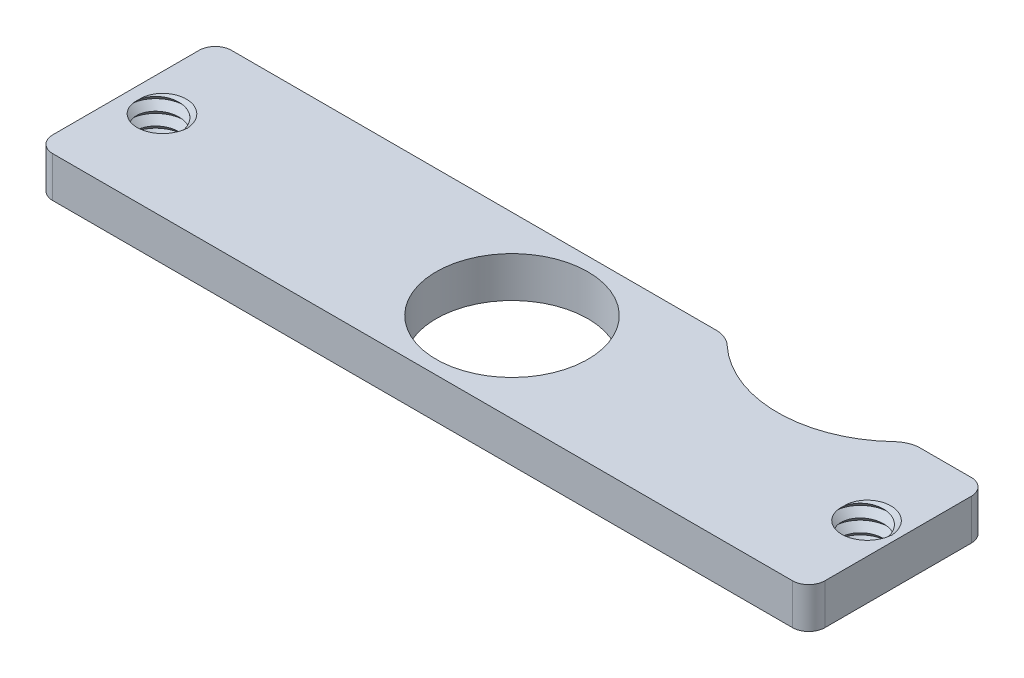
from build123d import *

# Parameters (mm, degrees)
SKETCH1_R           = 5
SKETCH1_R_2         = 17.78
BOSS_EXTRUDE1_DEPTH = 9.525
CUT_SWEEP1_PITCH    = 3
CUT_SWEEP3_PITCH    = 3
FILLET1_R           = 6.35
FILLET2_R           = 3.81


with BuildPart() as part:
    # Sketch1 → Boss-Extrude1 (new body)
    with BuildSketch(Plane(origin=(0, 0, 0), x_dir=(1, 0, 0), z_dir=(0, 1, 0))):
        with BuildLine():
            Line((-90.4875, 20.955), (-90.4875, -20.955))
            Line((-90.4875, -20.955), (90.4875, -20.955))
            Line((90.4875, -20.955), (90.4875, 20.955))
            Line((90.4875, 20.955), (72.098547486, 20.955))
            ThreePointArc((72.098547486, 20.955), (50.8, 11.43), (29.501452514, 20.955))
            Line((29.501452514, 20.955), (-90.4875, 20.955))
        make_face()
        with Locations(Location((-82.55, 0, 0), (0, 0, 90))):
            Circle(SKETCH1_R, mode=Mode.SUBTRACT)
        with Locations(Location((0, 0, 0), (0, 0, 90))):
            Circle(SKETCH1_R_2, mode=Mode.SUBTRACT)
        with Locations(Location((82.55, 0, 0), (0, 0, 90))):
            Circle(SKETCH1_R, mode=Mode.SUBTRACT)
    extrude(amount=BOSS_EXTRUDE1_DEPTH)

    # Cut-Sweep1: arcs per turn and ends read off the stored shape
    # Cut-Sweep1: the profile of Sketch5 profile screwed along a right-hand helix through 5 turns, 10 arcs to a turn; built about Z, then put on its axis
    cut_sweep1_z = Axis((0, 0, 0), (0, 0, 1))
    cut_sweep1_corners = [(4.9997, 0, -0.7497), (4.9997, 0, -3.7493), (6.4995, 0, -2.2495)]
    with BuildLine(mode=Mode.PRIVATE) as cut_sweep1_profile:
        Line(cut_sweep1_corners[0], cut_sweep1_corners[1])
        Line(cut_sweep1_corners[1], cut_sweep1_corners[2])
        Line(cut_sweep1_corners[2], cut_sweep1_corners[0])
    cut_sweep1_cap = Face(cut_sweep1_profile.wire())
    cut_sweep1_turn_angles = [0, 18, 36, 54, 72, 90, 108, 126, 144, 162, 180, 198, 216, 234, 252, 270, 288, 306, 324, 342, 360]
    cut_sweep1_turn_weights = [1, 0.9510565162951535, 1, 0.9510565162951535, 1, 0.9510565162951535, 1, 0.9510565162951535, 1, 0.9510565162951535, 1, 0.9510565162951535, 1, 0.9510565162951535, 1, 0.9510565162951535, 1, 0.9510565162951535, 1, 0.9510565162951535, 1]
    cut_sweep1_turn_rails = [Edge.make_bspline([Vector(p[0], p[1], 0).rotate(cut_sweep1_z, cut_sweep1_turn_angles[k]) / cut_sweep1_turn_weights[k] + Vector(0, 0, p[2] + CUT_SWEEP1_PITCH * cut_sweep1_turn_angles[k] / 360) for k in range(21)], [0, 0, 0, 1, 1, 2, 2, 3, 3, 4, 4, 5, 5, 6, 6, 7, 7, 8, 8, 9, 9, 10, 10, 10], 2, cut_sweep1_turn_weights) for p in cut_sweep1_corners]
    cut_sweep1_turn_sides = [Face.make_surface_from_curves(cut_sweep1_turn_rails[p[0]], cut_sweep1_turn_rails[p[1]]) for p in [(0, 1), (1, 2), (2, 0)]]
    cut_sweep1 = Plane(origin=(-82.55, 9.525, 0), x_dir=(0, 0, 1), z_dir=(0, -1, 0)) * Solid(Shell([*[p.moved(Location((0, 0, CUT_SWEEP1_PITCH * i))) for i in range(5) for p in cut_sweep1_turn_sides], cut_sweep1_cap, cut_sweep1_cap.rotate(cut_sweep1_z, 1800).moved(Location((0, 0, CUT_SWEEP1_PITCH * 1800 / 360)))]))
    add(cut_sweep1, mode=Mode.SUBTRACT)

    # Cut-Sweep3: arcs per turn and ends read off the stored shape
    # Cut-Sweep3: the profile of Sketch7 profile screwed along a right-hand helix through 5 turns, 10 arcs to a turn; built about Z, then put on its axis
    cut_sweep3_z = Axis((0, 0, 0), (0, 0, 1))
    cut_sweep3_corners = [(6.4995, 0, -2.2495), (4.9997, 0, -0.7497), (4.9997, 0, -3.7493)]
    with BuildLine(mode=Mode.PRIVATE) as cut_sweep3_profile:
        Line(cut_sweep3_corners[0], cut_sweep3_corners[1])
        Line(cut_sweep3_corners[1], cut_sweep3_corners[2])
        Line(cut_sweep3_corners[2], cut_sweep3_corners[0])
    cut_sweep3_cap = Face(cut_sweep3_profile.wire())
    cut_sweep3_turn_angles = [0, 18, 36, 54, 72, 90, 108, 126, 144, 162, 180, 198, 216, 234, 252, 270, 288, 306, 324, 342, 360]
    cut_sweep3_turn_weights = [1, 0.9510565162951535, 1, 0.9510565162951535, 1, 0.9510565162951535, 1, 0.9510565162951535, 1, 0.9510565162951535, 1, 0.9510565162951535, 1, 0.9510565162951535, 1, 0.9510565162951535, 1, 0.9510565162951535, 1, 0.9510565162951535, 1]
    cut_sweep3_turn_rails = [Edge.make_bspline([Vector(p[0], p[1], 0).rotate(cut_sweep3_z, cut_sweep3_turn_angles[k]) / cut_sweep3_turn_weights[k] + Vector(0, 0, p[2] + CUT_SWEEP3_PITCH * cut_sweep3_turn_angles[k] / 360) for k in range(21)], [0, 0, 0, 1, 1, 2, 2, 3, 3, 4, 4, 5, 5, 6, 6, 7, 7, 8, 8, 9, 9, 10, 10, 10], 2, cut_sweep3_turn_weights) for p in cut_sweep3_corners]
    cut_sweep3_turn_sides = [Face.make_surface_from_curves(cut_sweep3_turn_rails[p[0]], cut_sweep3_turn_rails[p[1]]) for p in [(0, 1), (1, 2), (2, 0)]]
    cut_sweep3 = Plane(origin=(82.55, 9.525, 0), x_dir=(0, 0, 1), z_dir=(0, -1, 0)) * Solid(Shell([*[p.moved(Location((0, 0, CUT_SWEEP3_PITCH * i))) for i in range(5) for p in cut_sweep3_turn_sides], cut_sweep3_cap, cut_sweep3_cap.rotate(cut_sweep3_z, 1800).moved(Location((0, 0, CUT_SWEEP3_PITCH * 1800 / 360)))]))
    add(cut_sweep3, mode=Mode.SUBTRACT)

    # Fillet1
    fillet1_edges = [part.edges().sort_by_distance(p)[0] for p in [
        (72.098547486, 4.7625, -20.955),
        (29.501452514, 4.7625, -20.955),
    ]]
    fillet(fillet1_edges, radius=FILLET1_R)

    # Fillet2
    fillet2_edges = [part.edges().sort_by_distance(p)[0] for p in [
        (90.4875, 4.7625, -20.955),
        (90.4875, 4.7625, 20.955),
        (-90.4875, 4.7625, 20.955),
        (-90.4875, 4.7625, -20.955),
    ]]
    fillet(fillet2_edges, radius=FILLET2_R)


solid = part.part
